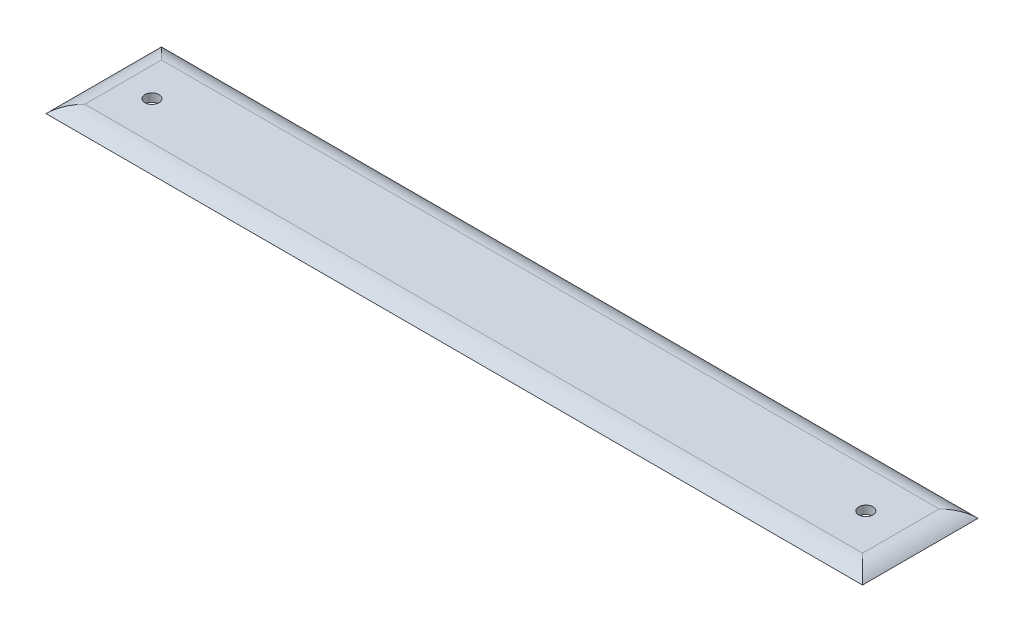
from build123d import *

# Parameters (mm, degrees)
SKETCH_1_W      = 21
SKETCH_1_H      = 42.43
SKETCH_1_R      = 2.6
EXTRUDE_1_DEPTH = 3
FILLET_1_R      = 10


with BuildPart() as part:
    # 草图1 → 凸台-拉伸1 (new body)
    # profile 1 of 3: a face of its own
    with BuildSketch(Plane(origin=(0, 0, 0), x_dir=(1, 0, 0), z_dir=(0, 1, 0))):
        with Locations((-139.5, 0)):
            Rectangle(SKETCH_1_W, SKETCH_1_H)
        with Locations(Location((-132.3, 0, 0), (0, 0, 270))):
            Circle(SKETCH_1_R, mode=Mode.SUBTRACT)
    # profile 2 of 3: a face of its own
    with BuildSketch(Plane(origin=(0, 0, 0), x_dir=(1, 0, 0), z_dir=(0, 1, 0))):
        with BuildLine():
            Line((129, 21.215), (-129, 21.215))
            Line((-129, 21.215), (-129, -21.215))
            Line((-129, -21.215), (129, -21.215))
            Line((129, -21.215), (129, -2.4))
            ThreePointArc((129, -2.4), (127.4, 0), (129, 2.4))
            Line((129, 2.4), (129, 21.215))
        make_face()
    # profile 3 of 3: a face of its own
    with BuildSketch(Plane(origin=(0, 0, 0), x_dir=(1, 0, 0), z_dir=(0, 1, 0))):
        with BuildLine():
            Line((150, 21.215), (129, 21.215))
            Line((129, 21.215), (129, 2.4))
            ThreePointArc((129, 2.4), (131.44222051, 2.163330765), (132.6, 0))
            ThreePointArc((132.6, 0), (131.44222051, -2.163330765), (129, -2.4))
            Line((129, -2.4), (129, -21.215))
            Line((129, -21.215), (150, -21.215))
            Line((150, -21.215), (150, 21.215))
        make_face()
    extrude(amount=EXTRUDE_1_DEPTH)

    # 圆角1
    # the kernel refuses this fillet: 10 mm, written as the material it takes off along each edge
    with BuildSketch(Plane(origin=(150, 3, 39.068571071), x_dir=(-1, 0, 0), z_dir=(0, 0, -1)), Plane(origin=(-150, 3, -39.068571071), x_dir=(1, 0, 0), z_dir=(0, 0, 1))) as fillet_1_piece_1:
        with BuildLine():
            CenterArc((7.141428429, -10), FILLET_1_R, 90, 45.572995999)
            Line((0, -3), (-0.142828569, -2.86))
            ThreePointArc((-0.142828569, -2.86), (-0.2, -1.5), (-0.2, 0))
            Line((-0.2, 0), (0, 0.2))
            Line((0, 0.2), (7.141428429, 0.2))
            Line((7.141428429, 0.2), (7.141428429, 0))
        make_face()
    extrude(amount=78.137142143, mode=Mode.SUBTRACT)
    with BuildSketch(Plane(origin=(-167.853571071, 3, 21.215), x_dir=(0, 0, -1), z_dir=(1, 0, 0))) as fillet_1_piece_2:
        with BuildLine():
            CenterArc((7.141428429, -10), FILLET_1_R, 90, 45.572995999)
            Line((0, -3), (-0.142828569, -2.86))
            ThreePointArc((-0.142828569, -2.86), (-0.2, -1.5), (-0.2, 0))
            Line((-0.2, 0), (0, 0.2))
            Line((0, 0.2), (7.141428429, 0.2))
            Line((7.141428429, 0.2), (7.141428429, 0))
        make_face()
    extrude(amount=335.707142143, mode=Mode.SUBTRACT)
    with BuildSketch(Plane(origin=(-167.853571071, 3, -21.215), x_dir=(0, -1, 0), z_dir=(1, 0, 0))) as fillet_1_piece_3:
        with BuildLine():
            CenterArc((10, -7.141428429), FILLET_1_R, 134.427004001, 45.572995999)
            Line((0, -7.141428429), (-0.2, -7.141428429))
            Line((-0.2, -7.141428429), (-0.2, 0))
            Line((-0.2, 0), (0, 0.2))
            ThreePointArc((0, 0.2), (1.5, 0.2), (2.86, 0.142828569))
            Line((2.86, 0.142828569), (3, 0))
        make_face()
    extrude(amount=335.707142143, mode=Mode.SUBTRACT)


solid = part.part
